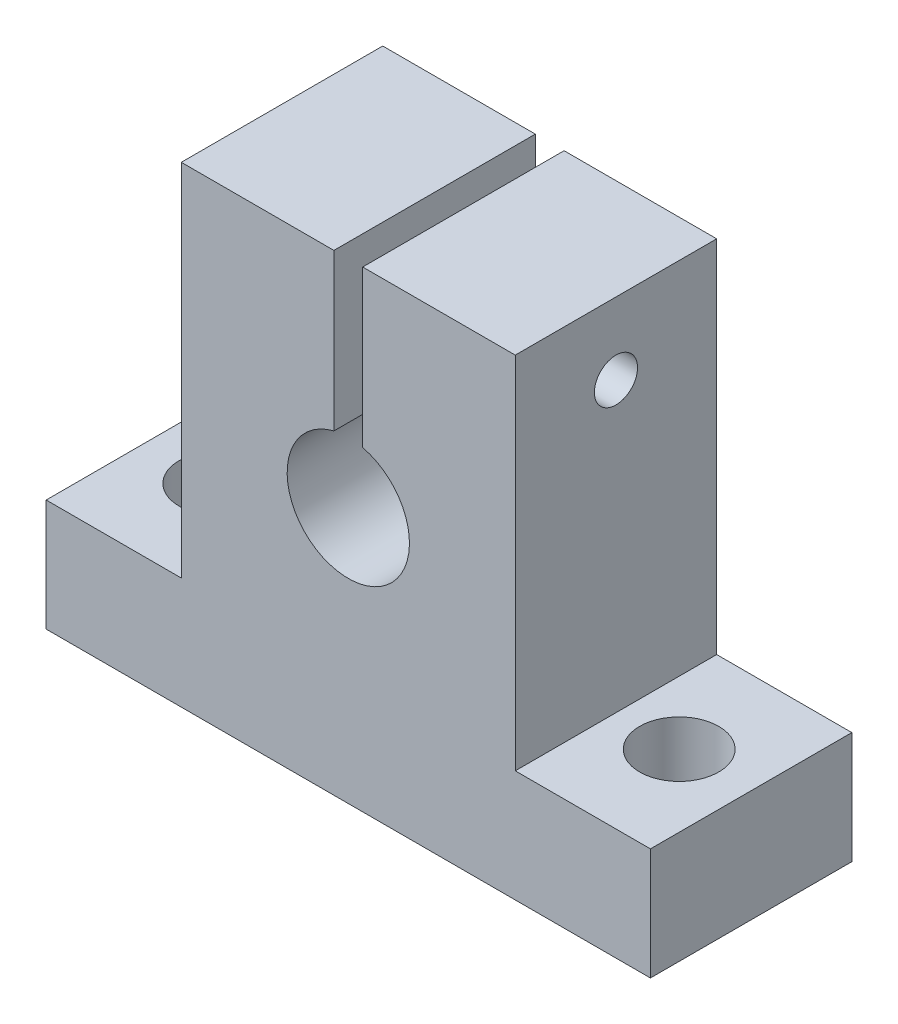
from build123d import *

# Parameters (mm, degrees)
BOSS_EXTRUDE1_DEPTH = 14
SKETCH2_R           = 4.25
CUT_EXTRUDE1_DEPTH  = 56.098457329
SKETCH3_R           = 2.75
CUT_EXTRUDE2_DEPTH  = 51.855770346
SKETCH4_R           = 1.5
CUT_EXTRUDE3_DEPTH  = 49.321882737


with BuildPart() as part:
    # Sketch1 → Boss-Extrude1 (new body)
    with BuildSketch(Plane.XY):
        Polygon((0, 0), (42, 0), (42, 7.773826152), (32.606201117, 7.773826152), (32.606201117, 32.8), (22, 32.8), (22, 17.8), (20, 17.8), (20, 32.8), (9.393798883, 32.8), (9.393798883, 7.773826152), (0, 7.773826152), align=None)
    extrude(amount=BOSS_EXTRUDE1_DEPTH)

    # Sketch2 → Cut-Extrude1 (cut, through all)
    with BuildSketch(Plane.XY.offset(14)):
        with Locations((21, 17.8)):
            Circle(SKETCH2_R)
    extrude(amount=-CUT_EXTRUDE1_DEPTH, mode=Mode.SUBTRACT)

    # Sketch3 → Cut-Extrude2 (cut, through all)
    with BuildSketch(Plane(origin=(0, 7.773826152, 0), x_dir=(1, 0, 0), z_dir=(0, 1, 0))):
        with Locations((5, -7)):
            Circle(SKETCH3_R)
        with Locations((37, -7)):
            Circle(SKETCH3_R)
    extrude(amount=-CUT_EXTRUDE2_DEPTH, mode=Mode.SUBTRACT)

    # Sketch4 → Cut-Extrude3 (cut, through all)
    with BuildSketch(Plane(origin=(32.606201117, 0, 0), x_dir=(0, 0, -1), z_dir=(1, 0, 0))):
        with Locations((-7, 27.8)):
            Circle(SKETCH4_R)
    extrude(amount=-CUT_EXTRUDE3_DEPTH, mode=Mode.SUBTRACT)


solid = part.part
